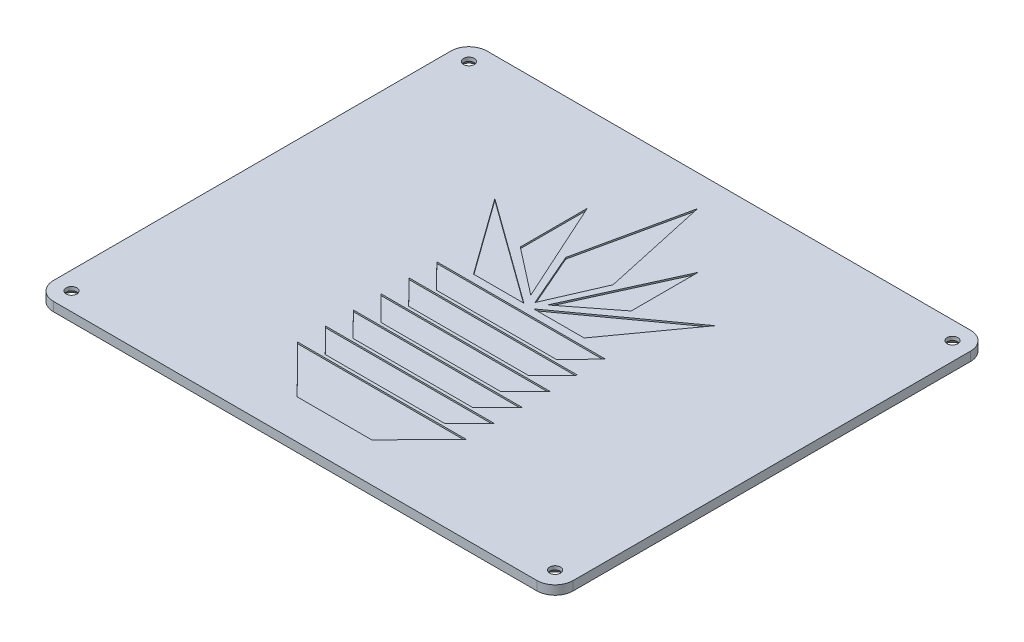
from build123d import *

# Parameters (mm, degrees)
SKETCH1_W                      = 86.201
SKETCH1_H                      = 71.913
BOSS_EXTRUDE1_DEPTH            = 1.5
FILLET1_R                      = 3
F_2_56_TAPPED_HOLE1_AT_2_COUNT = 2
F_2_56_TAPPED_HOLE1_AT_2_PITCH = 80.201
F_2_56_TAPPED_HOLE1_AT_3_COUNT = 2
F_2_56_TAPPED_HOLE1_AT_3_PITCH = 103.811001199
F_2_56_TAPPED_HOLE1_AT_4_COUNT = 2
F_2_56_TAPPED_HOLE1_AT_4_PITCH = 65.913
CUT_EXTRUDE1_START             = -0.25
CUT_EXTRUDE1_DEPTH             = 0.25


# Read off the part's stored shape, not the designer's step: Cut-Extrude1
with BuildPart() as part:
    # Sketch1 → Boss-Extrude1 (new body)
    with BuildSketch(Plane(origin=(0, 0, 0), x_dir=(1, 0, 0), z_dir=(0, 1, 0))):
        Rectangle(SKETCH1_W, SKETCH1_H)
    extrude(amount=BOSS_EXTRUDE1_DEPTH)

    # Fillet1
    fillet1_edges = [part.edges().sort_by_distance(p)[0] for p in [
        (43.1005, 0.75, 35.9565),
        (-43.1005, 0.75, 35.9565),
        (-43.1005, 0.75, -35.9565),
        (43.1005, 0.75, -35.9565),
    ]]
    fillet(fillet1_edges, radius=FILLET1_R)

    # Sketch4 → #2-56 Tapped Hole1 (revolve, cut)
    with BuildSketch(Plane(origin=(-40.1005, 0, 32.9565), x_dir=(0, 0, -1), z_dir=(1, 0, 0))):
        Polygon((0, 0), (0, 1.5), (0.889, 1.5), (0.889, 0.889), (1.778, 0), align=None)
    f_2_56_tapped_hole1 = revolve(axis=Axis((-40.1005, -6.35, 32.9565), (0, 1, 0)), mode=Mode.SUBTRACT)

    # #2-56 Tapped Hole1 at 2: #2-56 Tapped Hole1 ×2
    with Locations(*[(i * F_2_56_TAPPED_HOLE1_AT_2_PITCH, 0, 0) for i in range(1, F_2_56_TAPPED_HOLE1_AT_2_COUNT)]):
        add(f_2_56_tapped_hole1, mode=Mode.SUBTRACT)

    # #2-56 Tapped Hole1 at 3: #2-56 Tapped Hole1 ×2
    with Locations(*[Vector(0.7725674453907951, 0, -0.634932706924396) * (i * F_2_56_TAPPED_HOLE1_AT_3_PITCH) for i in range(1, F_2_56_TAPPED_HOLE1_AT_3_COUNT)]):
        add(f_2_56_tapped_hole1, mode=Mode.SUBTRACT)

    # #2-56 Tapped Hole1 at 4: #2-56 Tapped Hole1 ×2
    with Locations(*[(0, 0, -i * F_2_56_TAPPED_HOLE1_AT_4_PITCH) for i in range(1, F_2_56_TAPPED_HOLE1_AT_4_COUNT)]):
        add(f_2_56_tapped_hole1, mode=Mode.SUBTRACT)

    # Cut-Extrude1 outline → Cut-Extrude1 (cut)
    with BuildSketch(Plane(origin=(0, 1.5, 0), x_dir=(1, 0, 0), z_dir=(0, 1, 0)).offset(CUT_EXTRUDE1_START)):
        Polygon((-13.990667708, -16.934130724), (-9.929224496, -21.049984667), (9.929227007, -21.049984667), (13.990670219, -16.934130724), align=None)
        Polygon((-18.255824334, 15.410771968), (-9.171914583, 2.791562203), (-0.811527801, 2.791562203), align=None)
        Polygon((18.255804305, 15.410771968), (0.811507772, 2.791562203), (9.171894554, 2.791562203), align=None)
        Polygon((-9.194466068, 10.573407227), (-1.405683839, 4.516178709), (-9.194466068, 21.678326178), align=None)
        Polygon((-13.990667708, -12.320150377), (-9.929224496, -16.436026859), (9.929227007, -16.436026859), (13.990670219, -12.320150377), align=None)
        Polygon((-13.990667708, -7.70619257), (-9.929201956, -11.822069052), (9.929204467, -11.822069052), (13.990670219, -7.70619257), align=None)
        Polygon((-13.990667708, -3.092234762), (-9.929224496, -7.208088705), (9.929227007, -7.208088705), (13.990670219, -3.092234762), align=None)
        Polygon((-13.990667708, 1.521745585), (-9.929224496, -2.594130897), (9.929227007, -2.594130897), (13.990670219, 1.521745585), align=None)
        Polygon((0, 3.801099501), (3.926067099, 12.833705067), (0, 30.78030555), (-3.926067099, 12.833705067), align=None)
        Polygon((1.405683839, 4.516178709), (9.194466068, 10.573407227), (9.194466068, 21.678326178), align=None)
        Polygon((-6.186825635, -29.4565), (6.186825635, -29.4565), (13.990662514, -21.548093926), (-13.990662514, -21.548093926), align=None)
    extrude(amount=CUT_EXTRUDE1_DEPTH, mode=Mode.SUBTRACT)


solid = part.part
